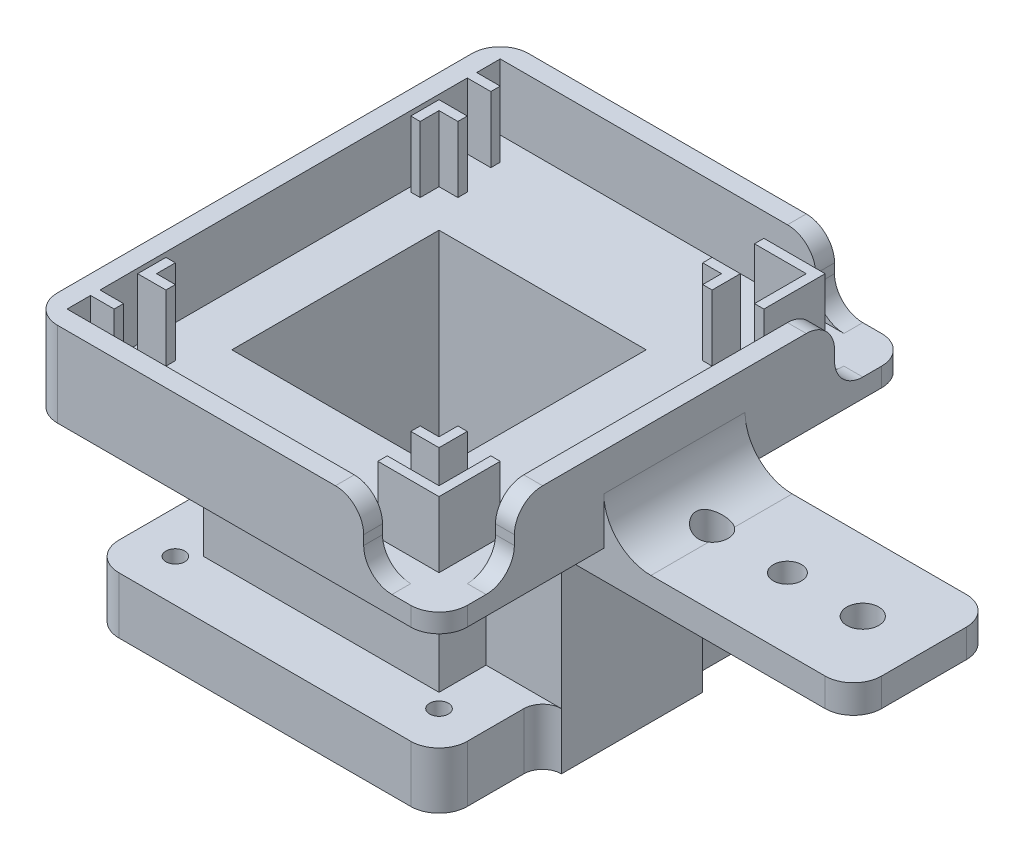
from build123d import *

# Parameters (mm, degrees)
SKETCH_2_W            = 37
SKETCH_2_H            = 37
EXTRUDE_1_DEPTH       = 23
SKETCH_3_W            = 22
SKETCH_3_H            = 22
CUT_EXTRUDE_1_DEPTH   = 23
SKETCH_19_OUTSIDE_W   = 50.432
SKETCH_19_OUTSIDE_H   = 50.432
SKETCH_19_OUTSIDE_W_2 = 25
SKETCH_19_OUTSIDE_H_2 = 25
CUT_EXTRUDE_17_DEPTH  = 17
SKETCH_4_W            = 50
SKETCH_4_H            = 50
EXTRUDE_2_DEPTH       = 9
SKETCH_5_W            = 46
SKETCH_5_H            = 46
CUT_EXTRUDE_3_DEPTH   = 7
SKETCH_12_W           = 8
SKETCH_12_H           = 8
CUT_EXTRUDE_14_DEPTH  = 14
SKETCH_6_W            = 22
SKETCH_6_H            = 22
CUT_EXTRUDE_4_DEPTH   = 2
SKETCH_11_R           = 1
CUT_EXTRUDE_7_DEPTH   = 8
SKETCH_13_W           = 41
SKETCH_13_H           = 41
SKETCH_13_W_2         = 39
SKETCH_13_H_2         = 39
EXTRUDE_3_DEPTH       = 7
SKETCH_17_W           = 32
SKETCH_17_H           = 32
SKETCH_17_W_2         = 30
SKETCH_17_H_2         = 30
EXTRUDE_4_DEPTH       = 7
SKETCH_15_W           = 28
SKETCH_15_H           = 1
SKETCH_15_W_2         = 1
SKETCH_15_H_2         = 28
CUT_EXTRUDE_15_DEPTH  = 7
SKETCH_18_W           = 1
SKETCH_18_H           = 26
SKETCH_18_W_2         = 26
SKETCH_18_H_2         = 1
CUT_EXTRUDE_16_DEPTH  = 7
SKETCH_20_W           = 3
SKETCH_20_H           = 10.5
CUT_EXTRUDE_18_DEPTH  = 3.5
SKETCH_21_W           = 4.5
SKETCH_21_H           = 10
CUT_EXTRUDE_19_DEPTH  = 1
SKETCH_22_W           = 5
SKETCH_22_H           = 1
CUT_EXTRUDE_21_DEPTH  = 7
SKETCH_24_W           = 6
SKETCH_24_H           = 4.5
CUT_EXTRUDE_22_DEPTH  = 1
SKETCH_25_W           = 6
SKETCH_25_H           = 15
EXTRUDE_5_DEPTH       = 17
SKETCH_26_W           = 15
SKETCH_26_H           = 3
EXTRUDE_6_DEPTH       = 33
SKETCH_28_W           = 6.5
SKETCH_28_H           = 50
CUT_EXTRUDE_27_DEPTH  = 13
SKETCH_32_W           = 2
SKETCH_32_H           = 50
EXTRUDE_9_DEPTH       = 9
FILLET_5_R            = 3
FILLET_6_R            = 3
FILLET_7_R            = 3
FILLET_8_R            = 3
FILLET_9_R            = 3
FILLET_10_R           = 3
FILLET_11_R           = 3
FILLET_12_R           = 3
FILLET_13_R           = 3
FILLET_14_R           = 3
FILLET_15_R           = 3
FILLET_16_R           = 3
FILLET_17_R           = 5
FILLET_19_R           = 3
FILLET_20_R           = 3
FILLET_21_R           = 3
FILLET_22_R           = 3
SKETCH_34_W           = 15
SKETCH_34_H           = 20
EXTRUDE_10_DEPTH      = 2
SKETCH_33_R           = 1.7
SKETCH_33_R_2         = 1.5
CUT_EXTRUDE_28_DEPTH  = 7
FILLET_23_R           = 3
FILLET_24_R           = 3
FILLET_25_R           = 2
FILLET_26_R           = 2


with BuildPart() as part:
    # 草图2 → 凸台-拉伸1 (new body)
    with BuildSketch(Plane(origin=(0, 0, 0), x_dir=(1, 0, 0), z_dir=(0, 1, 0))):
        Rectangle(SKETCH_2_W, SKETCH_2_H)
    extrude(amount=EXTRUDE_1_DEPTH)

    # 草图3 → 切除-拉伸1 (cut)
    with BuildSketch(Plane.XZ):
        Rectangle(SKETCH_3_W, SKETCH_3_H)
    extrude(amount=-CUT_EXTRUDE_1_DEPTH, mode=Mode.SUBTRACT)

    # 草图19 outside → 切除-拉伸17 (cut)
    with BuildSketch(Plane(origin=(0, 6, 0), x_dir=(-1, 0, 0), z_dir=(0, -1, 0))):
        Rectangle(SKETCH_19_OUTSIDE_W, SKETCH_19_OUTSIDE_H)
        Rectangle(SKETCH_19_OUTSIDE_W_2, SKETCH_19_OUTSIDE_H_2, mode=Mode.SUBTRACT)
    extrude(amount=-CUT_EXTRUDE_17_DEPTH, mode=Mode.SUBTRACT)

    # 草图4 → 凸台-拉伸2 (add)
    with BuildSketch(Plane(origin=(0, 23, 0), x_dir=(1, 0, 0), z_dir=(0, 1, 0))):
        Rectangle(SKETCH_4_W, SKETCH_4_H)
    extrude(amount=EXTRUDE_2_DEPTH)

    # 草图5 → 切除-拉伸3 (cut)
    with BuildSketch(Plane(origin=(0, 32, 0), x_dir=(1, 0, 0), z_dir=(0, 1, 0))):
        Rectangle(SKETCH_5_W, SKETCH_5_H)
    extrude(amount=-CUT_EXTRUDE_3_DEPTH, mode=Mode.SUBTRACT)

    # 草图12 → 切除-拉伸14 (cut)
    with BuildSketch(Plane(origin=(0, 25, 0), x_dir=(1, 0, 0), z_dir=(0, 1, 0))):
        with Locations((-21, -21)):
            Rectangle(SKETCH_12_W, SKETCH_12_H)
        with Locations((-21, 21)):
            Rectangle(SKETCH_12_W, SKETCH_12_H)
        with Locations((21, 21)):
            Rectangle(SKETCH_12_W, SKETCH_12_H)
        with Locations((21, -21)):
            Rectangle(SKETCH_12_W, SKETCH_12_H)
    extrude(amount=CUT_EXTRUDE_14_DEPTH, mode=Mode.SUBTRACT)

    # 草图6 → 切除-拉伸4 (cut)
    with BuildSketch(Plane(origin=(0, 25, 0), x_dir=(1, 0, 0), z_dir=(0, 1, 0))):
        Rectangle(SKETCH_6_W, SKETCH_6_H)
    extrude(amount=-CUT_EXTRUDE_4_DEPTH, mode=Mode.SUBTRACT)

    # 草图11 → 切除-拉伸7 (cut)
    with BuildSketch(Plane.XZ):
        with Locations(Location((14, 14, 0), (0, 0, 270))):
            Circle(SKETCH_11_R)
        with Locations(Location((14, -14, 0), (0, 0, 270))):
            Circle(SKETCH_11_R)
        with Locations(Location((-14, -14, 0), (0, 0, 270))):
            Circle(SKETCH_11_R)
        with Locations(Location((-14, 14, 0), (0, 0, 270))):
            Circle(SKETCH_11_R)
    extrude(amount=-CUT_EXTRUDE_7_DEPTH, mode=Mode.SUBTRACT)

    # 草图13 → 凸台-拉伸3 (add)
    with BuildSketch(Plane(origin=(0, 25, 0), x_dir=(1, 0, 0), z_dir=(0, 1, 0))):
        Rectangle(SKETCH_13_W, SKETCH_13_H)
        Rectangle(SKETCH_13_W_2, SKETCH_13_H_2, mode=Mode.SUBTRACT)
    extrude(amount=EXTRUDE_3_DEPTH)

    # 草图17 → 凸台-拉伸4 (add)
    with BuildSketch(Plane(origin=(0, 25, 0), x_dir=(1, 0, 0), z_dir=(0, 1, 0))):
        Rectangle(SKETCH_17_W, SKETCH_17_H)
        Rectangle(SKETCH_17_W_2, SKETCH_17_H_2, mode=Mode.SUBTRACT)
    extrude(amount=EXTRUDE_4_DEPTH)

    # 草图15 → 切除-拉伸15 (cut)
    with BuildSketch(Plane(origin=(0, 25, 0), x_dir=(1, 0, 0), z_dir=(0, 1, 0))):
        with Locations((0, -20)):
            Rectangle(SKETCH_15_W, SKETCH_15_H)
        with Locations((20, 0)):
            Rectangle(SKETCH_15_W_2, SKETCH_15_H_2)
        with Locations((-20, 0)):
            Rectangle(SKETCH_15_W_2, SKETCH_15_H_2)
        with Locations((0, 20)):
            Rectangle(SKETCH_15_W, SKETCH_15_H)
    extrude(amount=CUT_EXTRUDE_15_DEPTH, mode=Mode.SUBTRACT)

    # 草图18 → 切除-拉伸16 (cut)
    with BuildSketch(Plane(origin=(0, 25, 0), x_dir=(1, 0, 0), z_dir=(0, 1, 0))):
        with Locations((15.5, 0)):
            Rectangle(SKETCH_18_W, SKETCH_18_H)
        with Locations((0, -15.5)):
            Rectangle(SKETCH_18_W_2, SKETCH_18_H_2)
        with Locations((-15.5, 0)):
            Rectangle(SKETCH_18_W, SKETCH_18_H)
        with Locations((0, 15.5)):
            Rectangle(SKETCH_18_W_2, SKETCH_18_H_2)
    extrude(amount=CUT_EXTRUDE_16_DEPTH, mode=Mode.SUBTRACT)

    # 草图20 → 切除-拉伸18 (cut)
    with BuildSketch(Plane.XZ):
        with Locations((12.5, -5.25)):
            Rectangle(SKETCH_20_W, SKETCH_20_H)
    extrude(amount=-CUT_EXTRUDE_18_DEPTH, mode=Mode.SUBTRACT)

    # 草图21 → 切除-拉伸19 (cut)
    with BuildSketch(Plane.XZ):
        with Locations((-13.25, -2)):
            Rectangle(SKETCH_21_W, SKETCH_21_H)
    extrude(amount=-CUT_EXTRUDE_19_DEPTH, mode=Mode.SUBTRACT)

    # 草图22 → 切除-拉伸21 (cut)
    with BuildSketch(Plane.XZ):
        with Locations((0, -11.5)):
            Rectangle(SKETCH_22_W, SKETCH_22_H)
        with Locations((0, 11.5)):
            Rectangle(SKETCH_22_W, SKETCH_22_H)
    extrude(amount=-CUT_EXTRUDE_21_DEPTH, mode=Mode.SUBTRACT)

    # 草图24 → 切除-拉伸22 (cut)
    with BuildSketch(Plane.XZ):
        with Locations((-4.5, -13.25)):
            Rectangle(SKETCH_24_W, SKETCH_24_H)
    extrude(amount=-CUT_EXTRUDE_22_DEPTH, mode=Mode.SUBTRACT)

    # 草图25 → 凸台-拉伸5 (add)
    with BuildSketch(Plane(origin=(0, 6, 0), x_dir=(1, 0, 0), z_dir=(0, 1, 0))):
        with Locations((15.5, 0)):
            Rectangle(SKETCH_25_W, SKETCH_25_H)
    extrude(amount=EXTRUDE_5_DEPTH)

    # 草图26 → 凸台-拉伸6 (add)
    with BuildSketch(Plane(origin=(18.5, 0, 0), x_dir=(0, 0, -1), z_dir=(1, 0, 0))):
        with Locations((0, 21.5)):
            Rectangle(SKETCH_26_W, SKETCH_26_H)
    extrude(amount=EXTRUDE_6_DEPTH)

    # 草图28 → 切除-拉伸27 (cut)
    with BuildSketch(Plane.XZ.offset(-23)):
        with Locations((-21.75, 0)):
            Rectangle(SKETCH_28_W, SKETCH_28_H)
    extrude(amount=-CUT_EXTRUDE_27_DEPTH, mode=Mode.SUBTRACT)

    # 草图32 → 凸台-拉伸9 (add)
    with BuildSketch(Plane.XZ.offset(-23)):
        with Locations((-17.5, 0)):
            Rectangle(SKETCH_32_W, SKETCH_32_H)
    extrude(amount=-EXTRUDE_9_DEPTH)

    # 圆角5
    fillet_5_edges = [part.edges().sort_by_distance(p)[0] for p in [
        (25, 24, -25),
    ]]
    fillet(fillet_5_edges, radius=FILLET_5_R)

    # 圆角6
    fillet_6_edges = [part.edges().sort_by_distance(p)[0] for p in [
        (25, 24, 25),
    ]]
    fillet(fillet_6_edges, radius=FILLET_6_R)

    # 圆角7
    fillet_7_edges = [part.edges().sort_by_distance(p)[0] for p in [
        (-18.5, 27.5, -25),
    ]]
    fillet(fillet_7_edges, radius=FILLET_7_R)

    # 圆角8
    fillet_8_edges = [part.edges().sort_by_distance(p)[0] for p in [
        (-18.5, 27.5, 25),
    ]]
    fillet(fillet_8_edges, radius=FILLET_8_R)

    # 圆角9
    fillet_9_edges = [part.edges().sort_by_distance(p)[0] for p in [
        (17, 32, -24),
    ]]
    fillet(fillet_9_edges, radius=FILLET_9_R)

    # 圆角10
    fillet_10_edges = [part.edges().sort_by_distance(p)[0] for p in [
        (17, 25, -24),
    ]]
    fillet(fillet_10_edges, radius=FILLET_10_R)

    # 圆角11
    fillet_11_edges = [part.edges().sort_by_distance(p)[0] for p in [
        (24, 32, -17),
    ]]
    fillet(fillet_11_edges, radius=FILLET_11_R)

    # 圆角12
    fillet_12_edges = [part.edges().sort_by_distance(p)[0] for p in [
        (24, 25, -17),
    ]]
    fillet(fillet_12_edges, radius=FILLET_12_R)

    # 圆角13
    fillet_13_edges = [part.edges().sort_by_distance(p)[0] for p in [
        (17, 32, 24),
    ]]
    fillet(fillet_13_edges, radius=FILLET_13_R)

    # 圆角14
    fillet_14_edges = [part.edges().sort_by_distance(p)[0] for p in [
        (17, 25, 24),
    ]]
    fillet(fillet_14_edges, radius=FILLET_14_R)

    # 圆角15
    fillet_15_edges = [part.edges().sort_by_distance(p)[0] for p in [
        (24, 32, 17),
    ]]
    fillet(fillet_15_edges, radius=FILLET_15_R)

    # 圆角16
    fillet_16_edges = [part.edges().sort_by_distance(p)[0] for p in [
        (24, 25, 17),
    ]]
    fillet(fillet_16_edges, radius=FILLET_16_R)

    # 圆角17
    fillet_17_edges = [part.edges().sort_by_distance(p)[0] for p in [
        (25, 23, 0),
    ]]
    fillet(fillet_17_edges, radius=FILLET_17_R)

    # 圆角19
    fillet_19_edges = [part.edges().sort_by_distance(p)[0] for p in [
        (-18.5, 3, -18.5),
    ]]
    fillet(fillet_19_edges, radius=FILLET_19_R)

    # 圆角20
    fillet_20_edges = [part.edges().sort_by_distance(p)[0] for p in [
        (-18.5, 3, 18.5),
    ]]
    fillet(fillet_20_edges, radius=FILLET_20_R)

    # 圆角21
    fillet_21_edges = [part.edges().sort_by_distance(p)[0] for p in [
        (18.5, 3, 18.5),
    ]]
    fillet(fillet_21_edges, radius=FILLET_21_R)

    # 圆角22
    fillet_22_edges = [part.edges().sort_by_distance(p)[0] for p in [
        (18.5, 3, -18.5),
    ]]
    fillet(fillet_22_edges, radius=FILLET_22_R)

    # 草图34 → 凸台-拉伸10 (add)
    with BuildSketch(Plane(origin=(18.5, 0, 0), x_dir=(0, 0, -1), z_dir=(1, 0, 0))):
        with Locations((0, 10)):
            Rectangle(SKETCH_34_W, SKETCH_34_H)
    extrude(amount=EXTRUDE_10_DEPTH)

    # 草图33 → 切除-拉伸28 (cut)
    with BuildSketch(Plane.XZ.offset(-20)):
        with Locations(Location((29, 0, 0), (0, 0, 270))):
            Circle(SKETCH_33_R)
        with Locations(Location((37, 0, 0), (0, 0, 270))):
            Circle(SKETCH_33_R_2)
        with Locations(Location((45, 0, 0), (0, 0, 270))):
            Circle(SKETCH_33_R)
    extrude(amount=-CUT_EXTRUDE_28_DEPTH, mode=Mode.SUBTRACT)

    # 圆角23
    fillet_23_edges = [part.edges().sort_by_distance(p)[0] for p in [
        (51.5, 21.5, 7.5),
    ]]
    fillet(fillet_23_edges, radius=FILLET_23_R)

    # 圆角24
    fillet_24_edges = [part.edges().sort_by_distance(p)[0] for p in [
        (51.5, 21.5, -7.5),
    ]]
    fillet(fillet_24_edges, radius=FILLET_24_R)

    # 圆角25
    fillet_25_edges = [part.edges().sort_by_distance(p)[0] for p in [
        (18.5, 3, 7.5),
    ]]
    fillet(fillet_25_edges, radius=FILLET_25_R - 0.0001)  # a hair under: the kernel refuses the full size

    # 圆角26
    fillet_26_edges = [part.edges().sort_by_distance(p)[0] for p in [
        (18.5, 3, -7.5),
    ]]
    fillet(fillet_26_edges, radius=FILLET_26_R - 0.0001)  # a hair under: the kernel refuses the full size


solid = part.part
